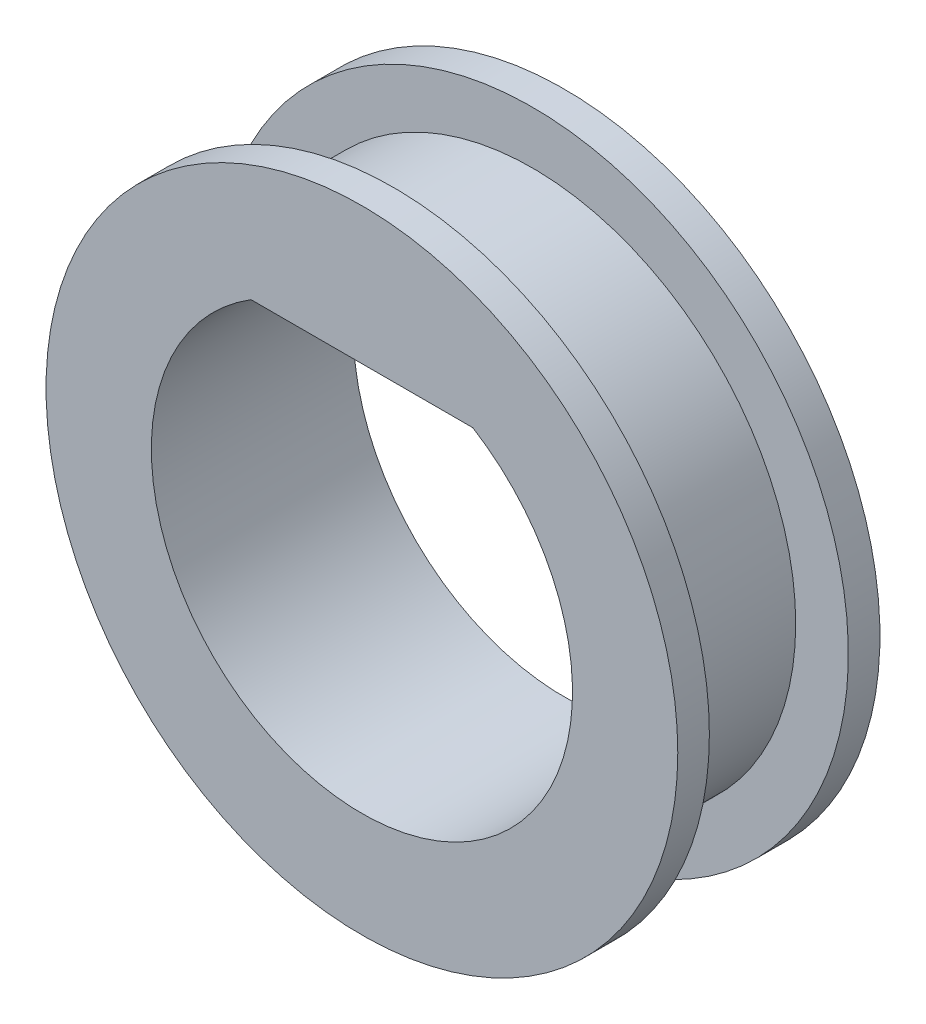
from build123d import *

# Parameters (mm, degrees)
SKETCH1_R               = 12.5
BOSS_EXTRUDE1_DEPTH     = 3.3
SKETCH2_R               = 15
BOSS_EXTRUDE2_DEPTH     = 1.5
BOSS_EXTRUDE3_START     = 1.5
SKETCH3_R               = 14.999999972
BOSS_EXTRUDE3_DEPTH     = 1.5
CUT_EXTRUDE1_DEPTH      = 24.284329494
CUT_EXTRUDE1_DEPTH_BACK = 24.284329494


with BuildPart() as part:
    # Sketch1 → Boss-Extrude1 (new, symmetric)
    with BuildSketch(Plane.XY):
        Circle(SKETCH1_R)
    extrude(amount=BOSS_EXTRUDE1_DEPTH, both=True)

    # Sketch2 → Boss-Extrude2 (add)
    with BuildSketch(Plane(origin=(0, 0, -3.3), x_dir=(-1, 0, 0), z_dir=(0, 0, -1))):
        Circle(SKETCH2_R)
    extrude(amount=BOSS_EXTRUDE2_DEPTH)

    # Sketch3 → Boss-Extrude3 (add)
    with BuildSketch(Plane.XY.offset(3.3).offset(BOSS_EXTRUDE3_START)):
        Circle(SKETCH3_R)
    extrude(amount=-BOSS_EXTRUDE3_DEPTH)

    # Sketch4 → Cut-Extrude1 (cut, two sides: drawn at the far end of the back side and taken through both)
    with BuildSketch(Plane.XY.offset(4.8).offset(-CUT_EXTRUDE1_DEPTH_BACK)):
        with BuildLine():
            Line((5.267826876, 8.5), (-5.267826876, 8.5))
            ThreePointArc((-5.267826876, 8.5), (-4.864243581, -8.737226927), (10, 0))
            ThreePointArc((10, 0), (8.737226927, 4.864243581), (5.267826876, 8.5))
        make_face()
    extrude(amount=CUT_EXTRUDE1_DEPTH + CUT_EXTRUDE1_DEPTH_BACK, mode=Mode.SUBTRACT)


solid = part.part
